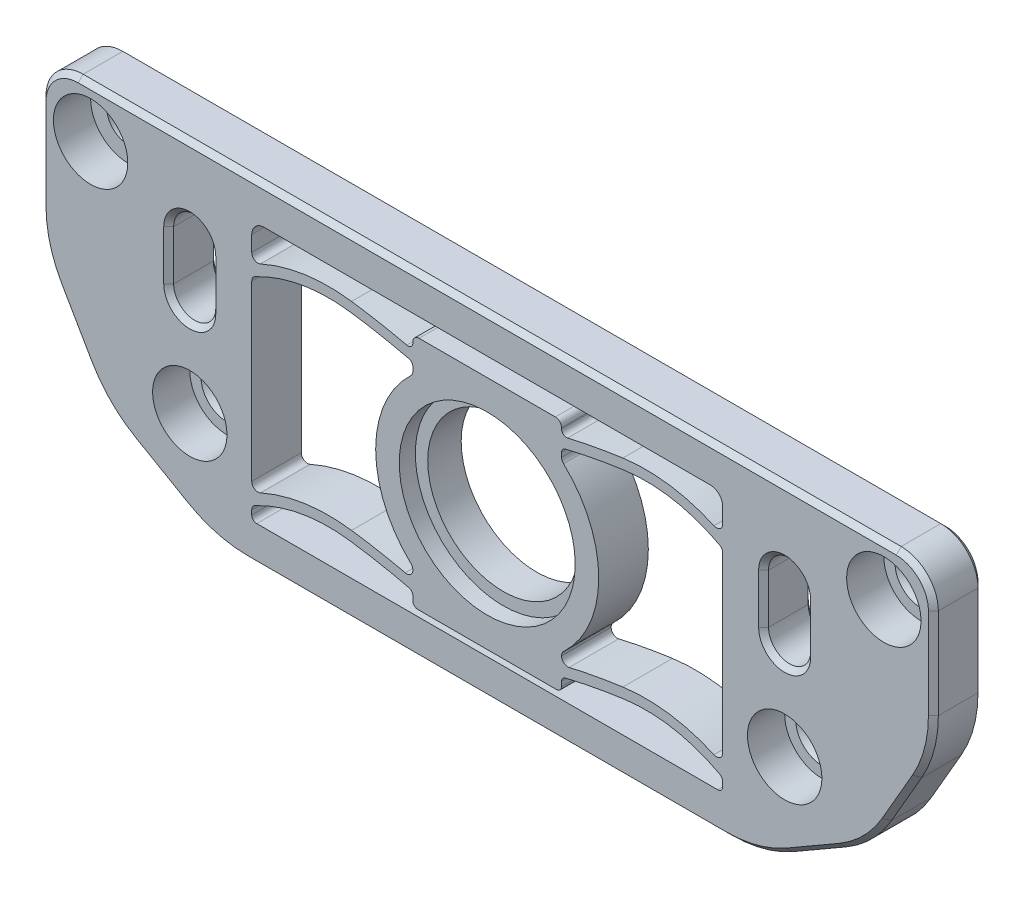
from build123d import *

# Parameters (mm, degrees)
SKETCH_2_R               = 7.1
SKETCH_2_R_2             = 6.1
EXTRUDE_1_DEPTH          = 2.7
SKETCH_2_3_R             = 9
SKETCH_2_3_R_2           = 7.1
EXTRUDE_2_DEPTH          = 4
EXTRUDE_3_DEPTH          = 4
SKETCH_4_W               = 44
SKETCH_4_H               = 27
SKETCH_4_W_2             = 38
SKETCH_4_H_2             = 21
EXTRUDE_4_DEPTH          = 4
EXTRUDE_1_2_DEPTH        = 4
DELETE_FACE_1_DEPTH      = 4
FILLET_4_R               = 0.5
FILLET_5_R               = 0.4
FILLET_6_R               = 1
SKETCH_8_R               = 1.7
EXTRUDE_7_DEPTH          = 4
CUT_EXTRUDE_1_DEPTH      = 39.832975817
CUT_EXTRUDE_1_DEPTH_BACK = 39.832975817
SKETCH_8_3_R             = 1.7
FILLET_7_R               = 10
FILLET_8_R               = 3
CUT_EXTRUDE_2_DEPTH      = 39.832975817
CUT_EXTRUDE_2_DEPTH_BACK = 3
SKETCH_10_R              = 3
CHAMFER_1_SIZE           = 0.4


# Read off the part's stored shape, not the designer's step: 删除面1
with BuildPart() as part:
    # 草图2 → Extrude 1 (new body)
    with BuildSketch(Plane.XY):
        with Locations(Location((0, 0, 0), (0, 0, 180))):
            Circle(SKETCH_2_R)
        with Locations(Location((0, 0, 0), (0, 0, 180))):
            Circle(SKETCH_2_R_2, mode=Mode.SUBTRACT)
    extrude(amount=EXTRUDE_1_DEPTH)

    # 草图2<3> → 凸台-拉伸2 (add)
    with BuildSketch(Plane.XY):
        Circle(SKETCH_2_3_R)
        Circle(SKETCH_2_3_R_2, mode=Mode.SUBTRACT)
    extrude(amount=EXTRUDE_2_DEPTH)

    # 草图3 → 凸台-拉伸3 (add)
    with BuildSketch(Plane.XY):
        with BuildLine():
            Line((6, 6.708203932), (6, 9.5))
            Line((6, 9.5), (-6, 9.5))
            Line((-6, 9.5), (-6, 6.708203932))
            ThreePointArc((-6, 6.708203932), (0, 9), (6, 6.708203932))
        make_face()
        with BuildLine():
            Line((-6, -9.5), (6, -9.5))
            Line((6, -9.5), (6, -6.708203932))
            ThreePointArc((6, -6.708203932), (0, -9), (-6, -6.708203932))
            Line((-6, -6.708203932), (-6, -9.5))
        make_face()
    extrude(amount=EXTRUDE_3_DEPTH)



with BuildPart() as body_2:
    # 草图4 → 凸台-拉伸4 (new body)
    with BuildSketch(Plane.XY):
        with Locations((0, 0.5)):
            Rectangle(SKETCH_4_W, SKETCH_4_H)
        with Locations((0, 0.5)):
            Rectangle(SKETCH_4_W_2, SKETCH_4_H_2, mode=Mode.SUBTRACT)
    extrude(amount=EXTRUDE_4_DEPTH)


with BuildPart() as part_1:
    add(part.part)

    add(body_2.part)  # Extrude 1 2 merges body 2
    # 草图7 → Extrude 1 2 (add)
    with BuildSketch(Plane.XY):
        with BuildLine():
            ThreePointArc((19.19111663, -8.148610709), (15.188418529, -6.736776188), (10.944962783, -6.647601418))
            ThreePointArc((10.944962783, -6.647601418), (8.412688328, -7.06534444), (5.904962783, -7.611454086))
            Line((5.904962783, -7.611454086), (6.095037217, -8.388545914))
            ThreePointArc((6.095037217, -8.388545914), (8.562957594, -7.851104675), (11.055037217, -7.439992495))
            ThreePointArc((11.055037217, -7.439992495), (15.04515232, -7.523843398), (18.80888337, -8.851389291))
            Line((18.80888337, -8.851389291), (19.19111663, -8.148610709))
        make_face()
        with BuildLine():
            ThreePointArc((-18.80888337, -8.851389291), (-15.04515232, -7.523843398), (-11.055037217, -7.439992495))
            ThreePointArc((-11.055037217, -7.439992495), (-8.562957594, -7.851104675), (-6.095037217, -8.388545914))
            Line((-6.095037217, -8.388545914), (-5.904962783, -7.611454086))
            ThreePointArc((-5.904962783, -7.611454086), (-8.412688328, -7.06534444), (-10.944962783, -6.647601418))
            ThreePointArc((-10.944962783, -6.647601418), (-15.188418529, -6.736776188), (-19.19111663, -8.148610709))
            Line((-19.19111663, -8.148610709), (-18.80888337, -8.851389291))
        make_face()
        with BuildLine():
            ThreePointArc((-18.80888337, 7.148610709), (-15.04515232, 8.476156602), (-11.055037217, 8.560007505))
            ThreePointArc((-11.055037217, 8.560007505), (-8.562957594, 8.148895325), (-6.095037217, 7.611454086))
            Line((-6.095037217, 7.611454086), (-5.904962783, 8.388545914))
            ThreePointArc((-5.904962783, 8.388545914), (-8.412688328, 8.93465556), (-10.944962783, 9.352398582))
            ThreePointArc((-10.944962783, 9.352398582), (-15.188418529, 9.263223812), (-19.19111663, 7.851389291))
            Line((-19.19111663, 7.851389291), (-18.80888337, 7.148610709))
        make_face()
        with BuildLine():
            ThreePointArc((19.19111663, 7.851389291), (15.188418529, 9.263223812), (10.944962783, 9.352398582))
            ThreePointArc((10.944962783, 9.352398582), (8.412688328, 8.93465556), (5.904962783, 8.388545914))
            Line((5.904962783, 8.388545914), (6.095037217, 7.611454086))
            ThreePointArc((6.095037217, 7.611454086), (8.562957594, 8.148895325), (11.055037217, 8.560007505))
            ThreePointArc((11.055037217, 8.560007505), (15.04515232, 8.476156602), (18.80888337, 7.148610709))
            Line((18.80888337, 7.148610709), (19.19111663, 7.851389291))
        make_face()
    extrude(amount=EXTRUDE_1_2_DEPTH)

    # Delete Face 1 outline → Delete Face 1 (add)
    with BuildSketch(Plane.XY):
        with BuildLine():
            ThreePointArc((-19, 7.042506057), (-18.904671788, 7.095972847), (-18.80888337, 7.148610709))
            Line((-18.80888337, 7.148610709), (-19, 7.5))
            Line((-19, 7.5), (-19, 7.042506057))
        make_face()
        with BuildLine():
            Line((-6, 7.588108866), (-6, 8))
            Line((-6, 8), (-6.095037217, 7.611454086))
            ThreePointArc((-6.095037217, 7.611454086), (-6.047512851, 7.599804915), (-6, 7.588108866))
        make_face()
        with BuildLine():
            ThreePointArc((-19, -8.957493943), (-18.904671788, -8.904027153), (-18.80888337, -8.851389291))
            Line((-18.80888337, -8.851389291), (-19, -8.5))
            Line((-19, -8.5), (-19, -8.957493943))
        make_face()
        with BuildLine():
            Line((-6, -8.411891134), (-6, -8))
            Line((-6, -8), (-6.095037217, -8.388545914))
            ThreePointArc((-6.095037217, -8.388545914), (-6.047512851, -8.400195085), (-6, -8.411891134))
        make_face()
        with BuildLine():
            Line((6.095037217, 7.611454086), (6, 8))
            Line((6, 8), (6, 7.588108866))
            ThreePointArc((6, 7.588108866), (6.047512851, 7.599804915), (6.095037217, 7.611454086))
        make_face()
        with BuildLine():
            Line((19, 7.5), (18.80888337, 7.148610709))
            ThreePointArc((18.80888337, 7.148610709), (18.904671788, 7.095972847), (19, 7.042506057))
            Line((19, 7.042506057), (19, 7.5))
        make_face()
        with BuildLine():
            Line((6.095037217, -8.388545914), (6, -8))
            Line((6, -8), (6, -8.411891134))
            ThreePointArc((6, -8.411891134), (6.047512851, -8.400195085), (6.095037217, -8.388545914))
        make_face()
        with BuildLine():
            Line((19, -8.5), (18.80888337, -8.851389291))
            ThreePointArc((18.80888337, -8.851389291), (18.904671788, -8.904027153), (19, -8.957493943))
            Line((19, -8.957493943), (19, -8.5))
        make_face()
    extrude(amount=DELETE_FACE_1_DEPTH)

    # 圆角4
    fillet_4_edges = [part_1.edges().sort_by_distance(p)[0] for p in [
        (19, -8.046657496, 2),
        (6, -7.588305973, 2),
        (-19, -8.046657496, 2),
        (-6, -7.588305973, 2),
        (-6, 9.5, 2),
        (6, 9.5, 2),
        (6, 6.708203932, 2),
        (-6, 6.708203932, 2),
        (19, -8.957493943, 2),
        (-19, -8.957493943, 2),
        (-19, 7.042506057, 2),
        (19, 7.042506057, 2),
        (6, -6.708203932, 2),
        (-6, -6.708203932, 2),
        (-19, 7.953342504, 2),
        (19, 7.953342504, 2),
    ]]
    fillet(fillet_4_edges, radius=FILLET_4_R)

    # 圆角5
    fillet_5_edges = [part_1.edges().sort_by_distance(p)[0] for p in [
        (6, -8.411891134, 2),
        (-6, -8.411891134, 2),
        (-6, 7.588108866, 2),
        (6, 7.588108866, 2),
        (-6, -9.5, 2),
        (6, -9.5, 2),
        (-6, 8.411694027, 2),
        (-19, -10, 2),
        (19, -10, 2),
        (6, 8.411694027, 2),
    ]]
    fillet(fillet_5_edges, radius=FILLET_5_R)

    # 圆角6
    fillet_6_edges = [part_1.edges().sort_by_distance(p)[0] for p in [
        (19, 11, 2),
        (-19, 11, 2),
    ]]
    fillet(fillet_6_edges, radius=FILLET_6_R)

    # 草图8 → 凸台-拉伸7 (add)
    # profile 1 of 2: a face of its own
    with BuildSketch(Plane.XY):
        Polygon((-30.875644347, -7.875644347), (-22, -13), (-22, 14), (-36, 14), (-36, 1), align=None)
        with BuildLine():
            ThreePointArc((-22.3, 3), (-24, 1.3), (-25.7, 3))
            Line((-25.7, 3), (-25.7, 7))
            ThreePointArc((-25.7, 7), (-24, 8.7), (-22.3, 7))
            Line((-22.3, 7), (-22.3, 3))
        make_face(mode=Mode.SUBTRACT)
        with Locations((-32, 10)):
            Circle(SKETCH_8_R, mode=Mode.SUBTRACT)
    # profile 2 of 2: a face of its own
    with BuildSketch(Plane.XY):
        Polygon((22, 14), (22, -13), (30.875644347, -7.875644347), (36, 1), (36, 14), align=None)
        with BuildLine():
            Line((25.7, 7), (25.7, 3))
            ThreePointArc((25.7, 3), (24, 1.3), (22.3, 3))
            Line((22.3, 3), (22.3, 7))
            ThreePointArc((22.3, 7), (24, 8.7), (25.7, 7))
        make_face(mode=Mode.SUBTRACT)
        with Locations((32, 10)):
            Circle(SKETCH_8_R, mode=Mode.SUBTRACT)
    extrude(amount=EXTRUDE_7_DEPTH)

    # 草图8<3> → 切除-拉伸1 (cut, two sides: drawn at the far end of the back side and taken through both)
    with BuildSketch(Plane.XY.offset(-CUT_EXTRUDE_1_DEPTH_BACK)):
        with Locations((-24, -5)):
            Circle(SKETCH_8_3_R)
        with BuildLine():
            Line((-22.3, 3), (-22.3, 7))
            ThreePointArc((-22.3, 7), (-24, 8.7), (-25.7, 7))
            Line((-25.7, 7), (-25.7, 3))
            ThreePointArc((-25.7, 3), (-24, 1.3), (-22.3, 3))
        make_face()
        with Locations((-32, 10)):
            Circle(SKETCH_8_3_R)
        with Locations((24, -5)):
            Circle(SKETCH_8_3_R)
        with Locations((32, 10)):
            Circle(SKETCH_8_3_R)
        with BuildLine():
            ThreePointArc((22.3, 7), (24, 8.7), (25.7, 7))
            Line((25.7, 7), (25.7, 3))
            ThreePointArc((25.7, 3), (24, 1.3), (22.3, 3))
            Line((22.3, 3), (22.3, 7))
        make_face()
    extrude(amount=CUT_EXTRUDE_1_DEPTH + CUT_EXTRUDE_1_DEPTH_BACK, mode=Mode.SUBTRACT)

    # 圆角7
    fillet_7_edges = [part_1.edges().sort_by_distance(p)[0] for p in [
        (-30.875644347, -7.875644347, 2),
        (-36, 1, 2),
        (30.875644347, -7.875644347, 2),
        (36, 1, 2),
        (22, -13, 2),
        (-22, -13, 2),
    ]]
    fillet(fillet_7_edges, radius=FILLET_7_R)

    # 圆角8
    fillet_8_edges = [part_1.edges().sort_by_distance(p)[0] for p in [
        (-36, 14, 2),
        (36, 14, 2),
    ]]
    fillet(fillet_8_edges, radius=FILLET_8_R)

    # 草图10 → 切除-拉伸2 (cut, two sides: drawn at the far end of the back side and taken through both)
    with BuildSketch(Plane.XY.offset(4).offset(-CUT_EXTRUDE_2_DEPTH_BACK)):
        with Locations(Location((-32, 10, 0), (0, 0, 180))):
            Circle(SKETCH_10_R)
        with Locations(Location((-24, -5, 0), (0, 0, 180))):
            Circle(SKETCH_10_R)
        with Locations(Location((24, -5, 0), (0, 0, 180))):
            Circle(SKETCH_10_R)
        with Locations(Location((32, 10, 0), (0, 0, 180))):
            Circle(SKETCH_10_R)
    extrude(amount=CUT_EXTRUDE_2_DEPTH + CUT_EXTRUDE_2_DEPTH_BACK, mode=Mode.SUBTRACT)

    # 倒角1
    chamfer_1_edges = [part_1.edges().sort_by_distance(p)[0] for p in [
        (-25.7, 5, 0),
        (-24, 1.3, 4),
        (-22.3, 5, 4),
        (-24, 8.7, 4),
        (-33.7, 10, 0),
        (-24, 8.7, 0),
        (-24, 1.3, 0),
        (-22.3, 5, 0),
        (-25.7, 5, 4),
        (22.3, 5, 0),
        (24, 8.7, 0),
        (25.7, 5, 4),
        (24, 1.3, 0),
        (30.3, 10, 0),
        (25.7, 5, 0),
        (24, 1.3, 4),
        (22.3, 5, 4),
        (24, 8.7, 4),
        (22.3, -5, 0),
        (-25.7, -5, 0),
        (36, 7.339745962, 4),
        (36, 7.339745962, 0),
        (33.437822174, -3.437822174, 0),
        (26.437822174, -10.437822174, 0),
        (0, -13, 0),
        (-26.437822174, -10.437822174, 0),
        (-33.437822174, -3.437822174, 0),
        (-36, 7.339745962, 0),
        (-21.908698527, -12.659258263, 0),
        (-30.626204083, -7.626204083, 0),
        (-35.659258263, 1.091301473, 0),
        (21.908698527, -12.659258263, 0),
        (30.626204083, -7.626204083, 0),
        (35.659258263, 1.091301473, 0),
        (33.437822174, -3.437822174, 4),
        (0, -13, 4),
        (26.437822174, -10.437822174, 4),
        (-36, 7.339745962, 4),
        (-33.437822174, -3.437822174, 4),
        (-26.437822174, -10.437822174, 4),
        (-21.908698527, -12.659258263, 4),
        (-30.626204083, -7.626204083, 4),
        (-35.659258263, 1.091301473, 4),
        (21.908698527, -12.659258263, 4),
        (30.626204083, -7.626204083, 4),
        (35.659258263, 1.091301473, 4),
        (0, 14, 0),
        (35.121320344, 13.121320344, 0),
        (-35.121320344, 13.121320344, 0),
        (0, 14, 4),
        (35.121320344, 13.121320344, 4),
        (-35.121320344, 13.121320344, 4),
        (-25.7, -5, 1),
        (22.3, -5, 1),
        (30.3, 10, 1),
    ]]
    chamfer(chamfer_1_edges, length=CHAMFER_1_SIZE)


solid = part_1.part
